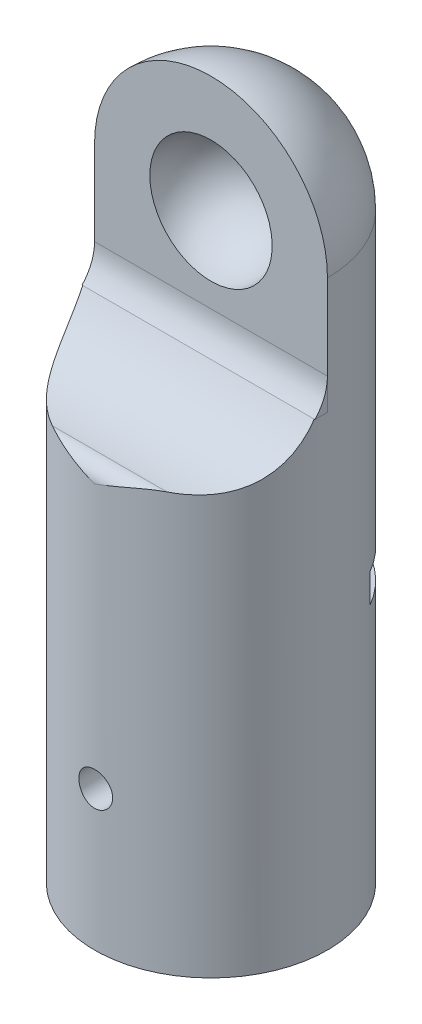
from build123d import *
from build123d.topology import SkipClean

# Parameters (mm, degrees)
SKETCH_1_R               = 10
EXTRUDE_1_DEPTH          = 30
SKETCH_2_R               = 7.05
CUT_EXTRUDE_1_DEPTH      = 20
REVOLVE_10_ANGLE         = 180
CUT_EXTRUDE_2_DEPTH      = 52.961524228
CUT_EXTRUDE_2_DEPTH_BACK = 52.961524228
EXTRUDE_2_DEPTH          = 10
CUT_EXTRUDE_START        = -2.5
CUT_EXTRUDE_3_DEPTH      = 2.5
EXTRUDE_START            = 10
SKETCH_11_R              = 10
SKETCH_11_R_2            = 7.05
EXTRUDE_3_DEPTH          = 10
HOLE_WIZARD_M2_5_1_D     = 2.9


# Read off the part's stored shape, not the designer's step: 회전1
with BuildPart() as part:
    # 스케치1 → 보스-돌출1 (new body)
    with BuildSketch(Plane(origin=(0, 0, 0), x_dir=(1, 0, 0), z_dir=(0, 1, 0))):
        with Locations(Location((0, 0, 0), (0, 0, 270))):
            Circle(SKETCH_1_R)
    extrude(amount=EXTRUDE_1_DEPTH)

    # 스케치2 → 컷-돌출1 (cut)
    with BuildSketch(Plane.XZ):
        with Locations(Location((0, 0, 0), (0, 0, 270))):
            Circle(SKETCH_2_R)
    extrude(amount=-CUT_EXTRUDE_1_DEPTH, mode=Mode.SUBTRACT)



with BuildPart() as body_2:
    # 회전1 outline → 회전1 (revolve)
    with BuildSketch(Plane.XZ.offset(-40)):
        with BuildLine():
            Line((0, 1e-08), (0, -10))
            ThreePointArc((0, -10), (7.071067815, -7.071067808), (10, 1e-08))
            Line((10, 1e-08), (0, 1e-08))
        make_face()
    revolve(axis=Axis((0, 40, 0), (0, 0, 1)))

    # 스케치5 → 컷-회전3 (revolve, cut)
    with BuildSketch(Plane.XY):
        with BuildLine():
            Line((0, 45.252296995), (0, 34.747703005))
            ThreePointArc((0, 34.747703005), (5.252296995, 40), (0, 45.252296995))
        make_face()
    revolve(axis=Axis((0, 0, 0), (0, 1, 0)), mode=Mode.SUBTRACT)


with BuildPart() as part_1:
    with SkipClean():  # the faces are left unmerged after this step: merging them gives an invalid solid
        add(part.part)

        add(body_2.part)  # 회전10 merges body 2
        # 스케치6 → 회전10 (revolve, symmetric)
        with BuildSketch(Plane(origin=(0, 0, 0), x_dir=(0, 0, -1), z_dir=(1, 0, 0))) as revolve_10_sk:
            with BuildLine():
                Line((0, 30), (0, 30.711529751))
                ThreePointArc((0, 30.711529751), (5.980054101, 33.531969517), (7.351370698, 40))
                Line((7.351370698, 40), (10, 40))
                Line((10, 40), (10, 30))
                Line((10, 30), (0, 30))
            make_face()
        revolve(axis=Axis((0, 0, 0), (0, 1, 0)), revolution_arc=REVOLVE_10_ANGLE / 2)
        revolve(revolve_10_sk.sketch, axis=Axis((0, 0, 0), (0, -1, 0)), revolution_arc=REVOLVE_10_ANGLE / 2)
    add(part_1.part.scale(1), mode=Mode.REPLACE)  # the faces are merged on a copy

    # 스케치7 → 컷-돌출2 (cut, two sides: drawn at the far end of the back side and taken through both)
    with BuildSketch(Plane(origin=(0, 0, 0), x_dir=(0, 0, -1), z_dir=(1, 0, 0)).offset(-CUT_EXTRUDE_2_DEPTH_BACK)):
        with BuildLine():
            Line((-10, 24.679295292), (-17.050906842, 49.125599249))
            Line((-17.050906842, 49.125599249), (0, 49.125599249))
            Line((0, 49.125599249), (0, 34.049122638))
            ThreePointArc((0, 34.049122638), (-2.58520571, 28.084119755), (-8.705629602, 25.892098007))
            ThreePointArc((-8.705629602, 25.892098007), (-9.615626451, 25.566183836), (-10, 24.679295292))
        make_face()
    extrude(amount=CUT_EXTRUDE_2_DEPTH + CUT_EXTRUDE_2_DEPTH_BACK, mode=Mode.SUBTRACT)

    # 스케치8 → 보스-돌출2 (add, symmetric)
    with BuildSketch(Plane(origin=(0, 0, 0), x_dir=(0, 0, -1), z_dir=(1, 0, 0))):
        with BuildLine():
            Line((0, 32.693889078), (0, 30))
            Line((0, 30), (-1.073327621, 30))
            ThreePointArc((-1.073327621, 30), (-0.278211386, 31.243969205), (0, 32.693889078))
        make_face()
    extrude(amount=EXTRUDE_2_DEPTH, both=True)

    # 스케치10 → 컷-돌출3 (cut)
    with BuildSketch(Plane(origin=(0, 15, 0), x_dir=(1, 0, 0), z_dir=(0, 1, 0)).offset(CUT_EXTRUDE_START)):
        with BuildLine():
            Line((-8.660254038, 5), (-3.31662479, 5))
            ThreePointArc((-3.31662479, 5), (0, 6), (3.31662479, 5))
            Line((3.31662479, 5), (8.660254038, 5))
            ThreePointArc((8.660254038, 5), (0, 10), (-8.660254038, 5))
        make_face()
    extrude(amount=CUT_EXTRUDE_3_DEPTH, mode=Mode.SUBTRACT)

    # 스케치11 → 보스-돌출3 (add)
    with BuildSketch(Plane.XZ.offset(EXTRUDE_START)):
        with Locations(Location((0, 0, 0), (0, 0, 270))):
            Circle(SKETCH_11_R)
        with Locations(Location((0, 0, 0), (0, 0, 270))):
            Circle(SKETCH_11_R_2, mode=Mode.SUBTRACT)
    extrude(amount=-EXTRUDE_3_DEPTH)

    # M2.5 여유 구멍1 (through all)
    with Locations(Plane.XY.offset(10)):
        with Locations((0, 2)):
            Hole(HOLE_WIZARD_M2_5_1_D / 2)


solid = part_1.part
